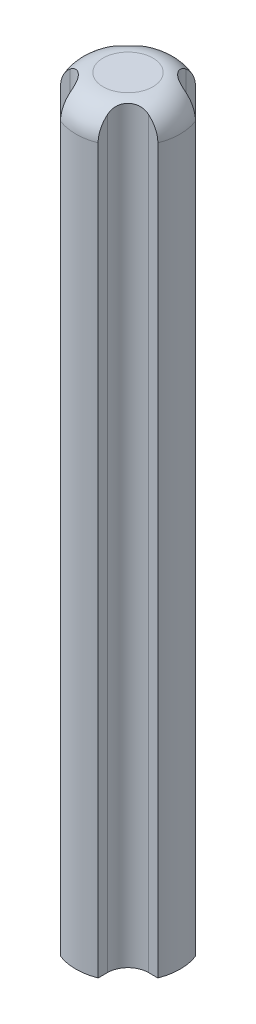
from build123d import *

# Parameters (mm, degrees)
SKETCH1_R           = 3.825
BOSS_EXTRUDE1_DEPTH = 55
FILLET1_R           = 2
SKETCH2_W           = 2.5
SKETCH2_H           = 2.5
CUT_EXTRUDE1_DEPTH  = 56.265371165
CIRPATTERN1_COUNT   = 4
FILLET2_R           = 1.5


with BuildPart() as part:
    # Sketch1 → Boss-Extrude1 (new body)
    with BuildSketch(Plane(origin=(0, 0, 0), x_dir=(1, 0, 0), z_dir=(0, 1, 0))):
        Circle(SKETCH1_R)
    extrude(amount=BOSS_EXTRUDE1_DEPTH)

    # Fillet1
    fillet1_edges = [part.edges().sort_by_distance(p)[0] for p in [
        (-3.825, 55, 0),
    ]]
    fillet(fillet1_edges, radius=FILLET1_R)

    # Sketch2 → Cut-Extrude1 (cut, through all)
    with BuildSketch(Plane(origin=(0, 55, 0), x_dir=(1, 0, 0), z_dir=(0, 1, 0))):
        with Locations((2.628858223, -2.628858223)):
            Rectangle(SKETCH2_W, SKETCH2_H)
    cut_extrude1 = extrude(amount=-CUT_EXTRUDE1_DEPTH, mode=Mode.SUBTRACT)

    # CirPattern1: Cut-Extrude1 ×4 about axis
    cirpattern1_axis = Axis((0, 55, 0), (0, 1, 0))
    for i in range(1, CIRPATTERN1_COUNT):
        add(cut_extrude1.rotate(cirpattern1_axis, i * 360 / CIRPATTERN1_COUNT), mode=Mode.SUBTRACT)

    # Fillet2
    fillet2_edges = [part.edges().sort_by_distance(p)[0] for p in [
        (1.378858223, 27.498044964, -1.378858223),
        (-1.378858223, 27.498044964, -1.378858223),
        (-1.378858223, 27.498044964, 1.378858223),
        (1.378858223, 27.498044964, 1.378858223),
    ]]
    fillet(fillet2_edges, radius=FILLET2_R)


solid = part.part
